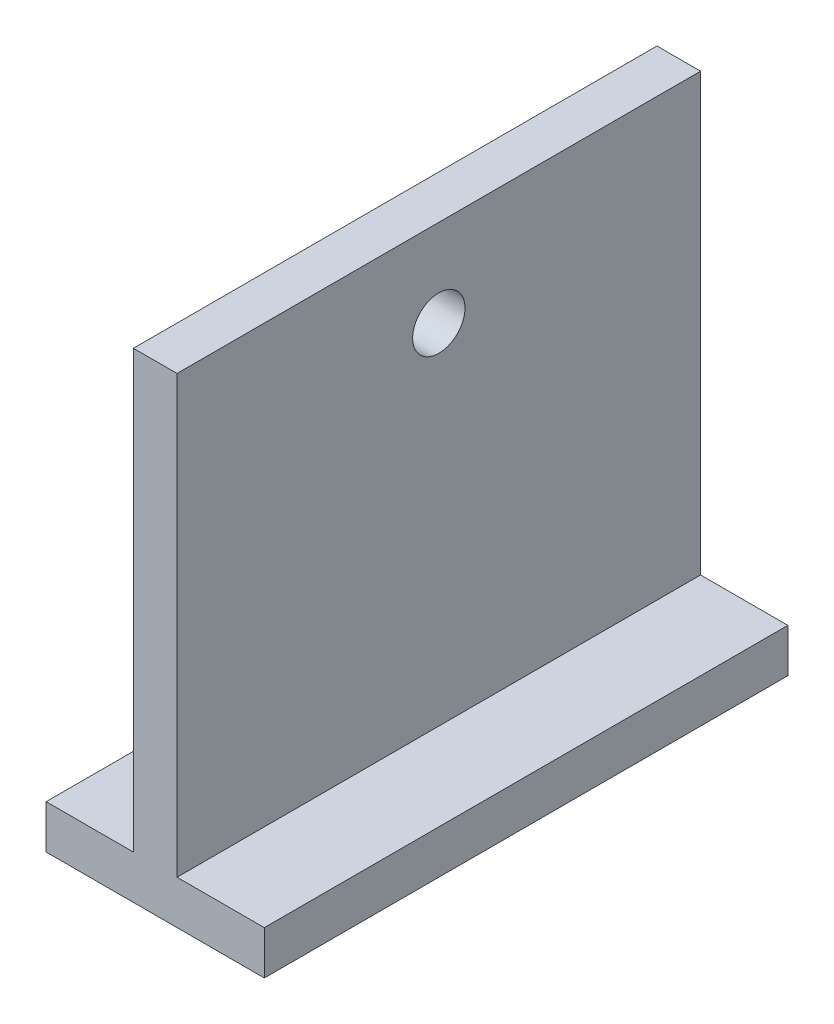
from build123d import *

# Parameters (mm, degrees)
BOSS_EXTRUDE1_DEPTH = 60
SKETCH2_R           = 3
CUT_EXTRUDE1_DEPTH  = 83.764726786


with BuildPart() as part:
    # Sketch1 → Boss-Extrude1 (new body)
    with BuildSketch(Plane.XY):
        Polygon((25, 0), (25, 5), (15, 5), (15, 55), (10, 55), (10, 5), (0, 5), (0, 0), align=None)
    extrude(amount=BOSS_EXTRUDE1_DEPTH)

    # Sketch2 → Cut-Extrude1 (cut, through all)
    with BuildSketch(Plane(origin=(15, 0, 0), x_dir=(0, 0, -1), z_dir=(1, 0, 0))):
        with Locations((-30, 45)):
            Circle(SKETCH2_R)
    extrude(amount=-CUT_EXTRUDE1_DEPTH, mode=Mode.SUBTRACT)


solid = part.part
